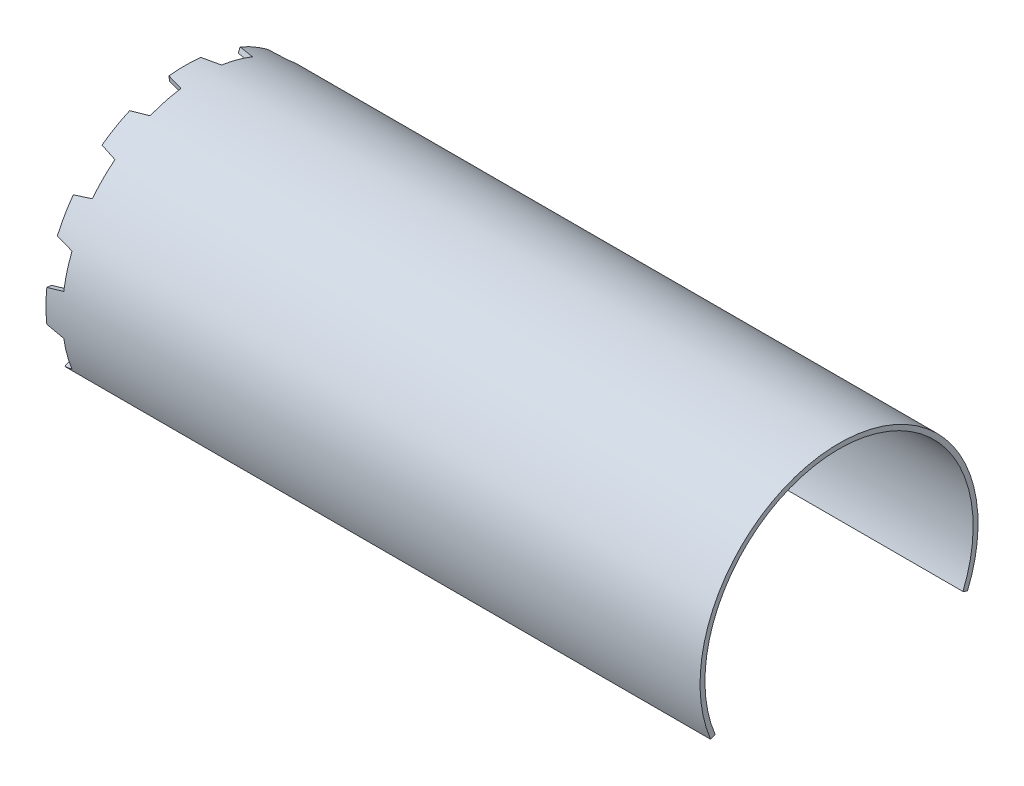
from build123d import *
from build123d.topology import SkipClean

# Parameters (mm, degrees)
SKETCH1_W                      = 390
SKETCH1_H                      = 3
BOSS_EXTRUDE1_DEPTH            = 5
DRAFT1_ANGLE                   = -15
CIRPATTERN1_COUNT              = 12
DRAFT1_OF_CIRPATTERN1_2_ANGLE  = -15
DRAFT1_OF_CIRPATTERN1_3_ANGLE  = -15
DRAFT1_OF_CIRPATTERN1_4_ANGLE  = -15
DRAFT1_OF_CIRPATTERN1_5_ANGLE  = -15
DRAFT1_OF_CIRPATTERN1_6_ANGLE  = -15
DRAFT1_OF_CIRPATTERN1_7_ANGLE  = -15
DRAFT1_OF_CIRPATTERN1_8_ANGLE  = -15
DRAFT1_OF_CIRPATTERN1_9_ANGLE  = -15
DRAFT1_OF_CIRPATTERN1_10_ANGLE = -15
DRAFT1_OF_CIRPATTERN1_11_ANGLE = -15
DRAFT1_OF_CIRPATTERN1_12_ANGLE = -15
SKETCH3_OUTSIDE_W              = 265.338
SKETCH3_OUTSIDE_H              = 265.338
CUT_EXTRUDE1_DEPTH             = 563.983125857


with BuildPart() as part:
    # Sketch1 → Revolve1 (revolve)
    with BuildSketch(Plane.XY):
        with Locations((355, 83.5)):
            Rectangle(SKETCH1_W, SKETCH1_H)
    revolve(axis=Axis((0, 0, 0), (1, 0, 0)))

    # Sketch2 → Boss-Extrude1 (add, symmetric)
    with SkipClean():  # the faces are left unmerged after this step: merging them gives an invalid solid
        with BuildSketch(Plane(origin=(155, 0, 0), x_dir=(0, 0, -1), z_dir=(1, 0, 0))):
            with BuildLine():
                Line((10.703147762, 81.298478633), (11.094726339, 84.272813217))
                ThreePointArc((11.094726339, 84.272813217), (0, 85), (-11.094726339, 84.272813217))
                Line((-11.094726339, 84.272813217), (-10.703147762, 81.298478633))
                ThreePointArc((-10.703147762, 81.298478633), (0, 82), (10.703147762, 81.298478633))
            make_face()
        boss_extrude1 = extrude(amount=BOSS_EXTRUDE1_DEPTH, both=True)

    # Draft1
    draft1_faces = [part.faces().sort_by_distance(p)[0] for p in [
        (155, 82.785645925, 10.89893705),
        (155, 82.785645925, -10.89893705),
    ]]
    draft(draft1_faces, Plane(origin=(155, 0, 0), x_dir=(0, 0, 1), z_dir=(1, 0, 0)), DRAFT1_ANGLE)

    # CirPattern1: Boss-Extrude1 ×12 about axis
    with SkipClean():  # the faces are left unmerged after this step: merging them gives an invalid solid
        cirpattern1_axis = Axis((0, 0, 0), (-1, 0, 0))
        for i in range(1, CIRPATTERN1_COUNT):
            add(boss_extrude1.rotate(cirpattern1_axis, i * 360 / CIRPATTERN1_COUNT))

    # Draft1 of CirPattern1 2
    draft1_of_cirpattern1_2_faces = [part.faces().sort_by_distance(p)[0] for p in [
        (155, 77.143940965, -31.954066602),
        (155, 66.245003914, -50.831579322),
    ]]
    draft(draft1_of_cirpattern1_2_faces, Plane(origin=(155, 0, 0), x_dir=(0, 0.49999999999999994, 0.8660254037844387), z_dir=(1, 0, 0)), DRAFT1_OF_CIRPATTERN1_2_ANGLE)

    # Draft1 of CirPattern1 3
    draft1_of_cirpattern1_3_faces = [part.faces().sort_by_distance(p)[0] for p in [
        (155, 50.831579322, -66.245003914),
        (155, 31.954066602, -77.143940965),
    ]]
    draft(draft1_of_cirpattern1_3_faces, Plane(origin=(155, 0, 0), x_dir=(0, 0.8660254037844386, 0.5000000000000001), z_dir=(1, 0, 0)), DRAFT1_OF_CIRPATTERN1_3_ANGLE)

    # Draft1 of CirPattern1 4
    draft1_of_cirpattern1_4_faces = [part.faces().sort_by_distance(p)[0] for p in [
        (155, 10.89893705, -82.785645925),
        (155, -10.89893705, -82.785645925),
    ]]
    draft(draft1_of_cirpattern1_4_faces, Plane.YZ.offset(155), DRAFT1_OF_CIRPATTERN1_4_ANGLE)

    # Draft1 of CirPattern1 5
    draft1_of_cirpattern1_5_faces = [part.faces().sort_by_distance(p)[0] for p in [
        (155, -31.954066602, -77.143940965),
        (155, -50.831579322, -66.245003914),
    ]]
    draft(draft1_of_cirpattern1_5_faces, Plane(origin=(155, 0, 0), x_dir=(0, 0.8660254037844387, -0.4999999999999998), z_dir=(1, 0, 0)), DRAFT1_OF_CIRPATTERN1_5_ANGLE)

    # Draft1 of CirPattern1 6
    draft1_of_cirpattern1_6_faces = [part.faces().sort_by_distance(p)[0] for p in [
        (155, -66.245003914, -50.831579322),
        (155, -77.143940965, -31.954066602),
    ]]
    draft(draft1_of_cirpattern1_6_faces, Plane(origin=(155, 0, 0), x_dir=(0, 0.49999999999999994, -0.8660254037844387), z_dir=(1, 0, 0)), DRAFT1_OF_CIRPATTERN1_6_ANGLE)

    # Draft1 of CirPattern1 7
    draft1_of_cirpattern1_7_faces = [part.faces().sort_by_distance(p)[0] for p in [
        (155, -82.785645925, -10.89893705),
        (155, -82.785645925, 10.89893705),
    ]]
    draft(draft1_of_cirpattern1_7_faces, Plane(origin=(155, 0, 0), x_dir=(0, 0, -1), z_dir=(1, 0, 0)), DRAFT1_OF_CIRPATTERN1_7_ANGLE)

    # Draft1 of CirPattern1 8
    draft1_of_cirpattern1_8_faces = [part.faces().sort_by_distance(p)[0] for p in [
        (155, -77.143940965, 31.954066602),
        (155, -66.245003914, 50.831579322),
    ]]
    draft(draft1_of_cirpattern1_8_faces, Plane(origin=(155, 0, 0), x_dir=(0, -0.5000000000000001, -0.8660254037844386), z_dir=(1, 0, 0)), DRAFT1_OF_CIRPATTERN1_8_ANGLE)

    # Draft1 of CirPattern1 9
    draft1_of_cirpattern1_9_faces = [part.faces().sort_by_distance(p)[0] for p in [
        (155, -50.831579322, 66.245003914),
        (155, -31.954066602, 77.143940965),
    ]]
    draft(draft1_of_cirpattern1_9_faces, Plane(origin=(155, 0, 0), x_dir=(0, -0.8660254037844384, -0.5000000000000004), z_dir=(1, 0, 0)), DRAFT1_OF_CIRPATTERN1_9_ANGLE)

    # Draft1 of CirPattern1 10
    draft1_of_cirpattern1_10_faces = [part.faces().sort_by_distance(p)[0] for p in [
        (155, -10.89893705, 82.785645925),
        (155, 10.89893705, 82.785645925),
    ]]
    draft(draft1_of_cirpattern1_10_faces, Plane(origin=(155, 0, 0), x_dir=(0, -1, 0), z_dir=(1, 0, 0)), DRAFT1_OF_CIRPATTERN1_10_ANGLE)

    # Draft1 of CirPattern1 11
    draft1_of_cirpattern1_11_faces = [part.faces().sort_by_distance(p)[0] for p in [
        (155, 31.954066602, 77.143940965),
        (155, 50.831579322, 66.245003914),
    ]]
    draft(draft1_of_cirpattern1_11_faces, Plane(origin=(155, 0, 0), x_dir=(0, -0.8660254037844386, 0.5000000000000001), z_dir=(1, 0, 0)), DRAFT1_OF_CIRPATTERN1_11_ANGLE)

    # Draft1 of CirPattern1 12
    draft1_of_cirpattern1_12_faces = [part.faces().sort_by_distance(p)[0] for p in [
        (155, 66.245003914, 50.831579322),
        (155, 77.143940965, 31.954066602),
    ]]
    draft(draft1_of_cirpattern1_12_faces, Plane(origin=(155, 0, 0), x_dir=(0, -0.5000000000000004, 0.8660254037844384), z_dir=(1, 0, 0)), DRAFT1_OF_CIRPATTERN1_12_ANGLE)

    # Sketch3 outside → Cut-Extrude1 (cut, through all)
    with SkipClean():  # the faces are left unmerged after this step: merging them gives an invalid solid
        with BuildSketch(Plane(origin=(0, 0, 0), x_dir=(0, 0, -1), z_dir=(1, 0, 0))):
            Rectangle(SKETCH3_OUTSIDE_W, SKETCH3_OUTSIDE_H)
            with BuildLine():
                Line((0, 0), (-78.529760263, -32.528091751))
                ThreePointArc((-78.529760263, -32.528091751), (0, 85), (78.529760263, -32.528091751))
                Line((78.529760263, -32.528091751), (0, 0))
            make_face(mode=Mode.SUBTRACT)
        extrude(amount=CUT_EXTRUDE1_DEPTH, mode=Mode.SUBTRACT)


solid = part.part
